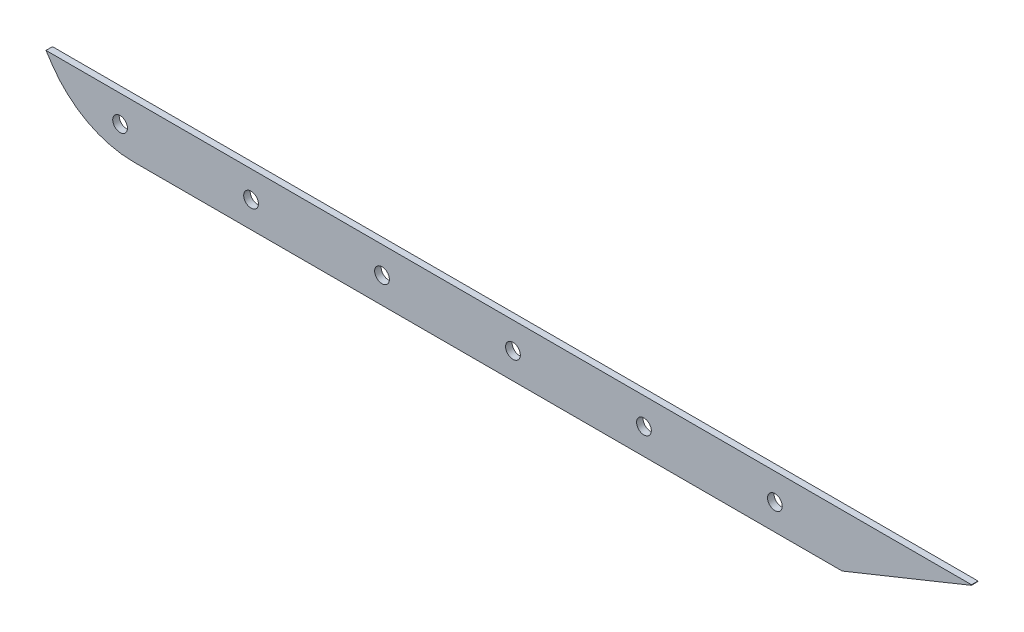
from build123d import *

# Parameters (mm, degrees)
BOSS_EXTRUDE1_DEPTH = 3.175
SKETCH1_4_R         = 3.6
CUT_EXTRUDE1_DEPTH  = 439.905857431
FILLET1_R           = 48
CUT_EXTRUDE3_DEPTH  = 10
CUT_EXTRUDE5_DEPTH  = 10


with BuildPart() as part:
    # Sketch1 → Boss-Extrude1 (new body)
    with BuildSketch(Plane.XY):
        Polygon((428.120588235, 28.939617947), (0.540381846, 28.939617947), (-115.605170134, 28.939617947), (-98.879411765, 3.850980392), (-31.879411765, -96.649019608), (366, -96.649019608), (403.120588235, -71.149019608), align=None)
    extrude(amount=BOSS_EXTRUDE1_DEPTH)

    # Sketch1<4> → Cut-Extrude1 (cut, through all)
    with BuildSketch(Plane.XY):
        with Locations((-12.879411765, -83.899019608)):
            Circle(SKETCH1_4_R)
        with Locations((51.120588235, -83.899019608)):
            Circle(SKETCH1_4_R)
        with Locations((115.120588235, -83.899019608)):
            Circle(SKETCH1_4_R)
        with Locations((179.120588235, -83.899019608)):
            Circle(SKETCH1_4_R)
        with Locations((243.120588235, -83.899019608)):
            Circle(SKETCH1_4_R)
        with Locations((307.120588235, -83.899019608)):
            Circle(SKETCH1_4_R)
    extrude(amount=CUT_EXTRUDE1_DEPTH, mode=Mode.SUBTRACT)

    # Fillet1
    fillet1_edges = [part.edges().sort_by_distance(p)[0] for p in [
        (-31.879411765, -96.649019608, 1.5875),
    ]]
    fillet(fillet1_edges, radius=FILLET1_R)

    # Sketch7 → Cut-Extrude3 (cut)
    with BuildSketch(Plane.XY.offset(3.175)):
        Polygon((403.120588235, -71.149019608), (340.005873473, -96.649019608), (366, -96.649019608), align=None)
    extrude(amount=-CUT_EXTRUDE3_DEPTH, mode=Mode.SUBTRACT)

    # Sketch10 → Cut-Extrude5 (cut)
    with BuildSketch(Plane.XY.offset(3.175)):
        Polygon((-49.086078431, -70.839019608), (403.198019602, -70.839019608), (428.120588235, 28.939617947), (-115.605170134, 28.939617947), align=None)
    extrude(amount=-CUT_EXTRUDE5_DEPTH, mode=Mode.SUBTRACT)


solid = part.part
